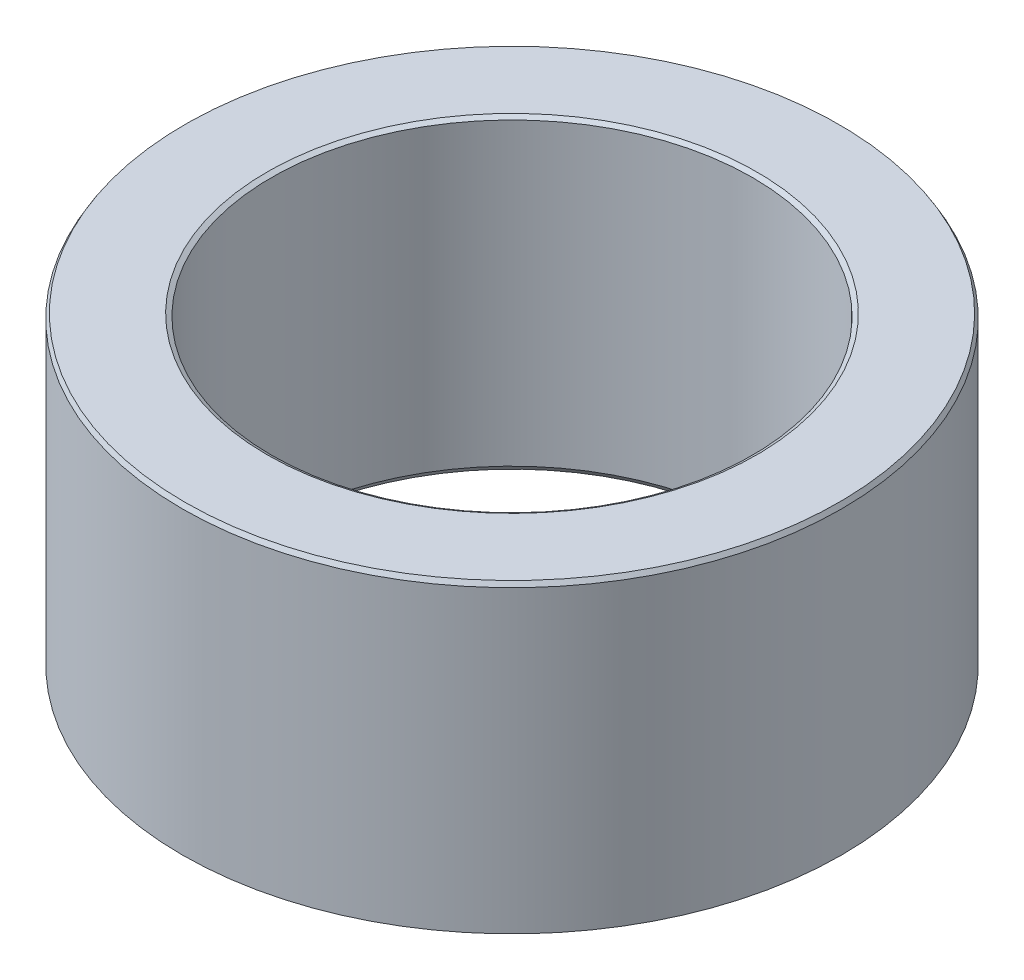
from build123d import *
from OCP.BRepFilletAPI import BRepFilletAPI_MakeChamfer

# Parameters (mm, degrees)
SKETCH1_R           = 42.5
BOSS_EXTRUDE1_DEPTH = 39.545728752
SKETCH2_R           = 31.003507725
CUT_EXTRUDE1_DEPTH  = 72.946957285
CHAMFER1_SIZE       = 0.571269979
CHAMFER1_SIZE2      = 0.329822876


with BuildPart() as part:
    # Sketch1 → Boss-Extrude1 (new body)
    with BuildSketch(Plane(origin=(0, 0, 0), x_dir=(1, 0, 0), z_dir=(0, 1, 0))):
        Circle(SKETCH1_R)
    extrude(amount=BOSS_EXTRUDE1_DEPTH)

    # Sketch2 → Cut-Extrude1 (cut, through all)
    with BuildSketch(Plane(origin=(0, 0, 0), x_dir=(1, 0, 0), z_dir=(0, 1, 0))):
        Circle(SKETCH2_R)
    extrude(amount=CUT_EXTRUDE1_DEPTH, mode=Mode.SUBTRACT)

    # Chamfer1: one chamfer whose edges measure the first distance from different faces: ONE call of the kernel's chamfer builder (chamfer() names one face for all edges)
    chamfer1_edges_1 = [part.edges().sort_by_distance(p)[0] for p in [
        (-31.003507725, 39.545728752, 0),
    ]]
    chamfer1_side_1 = [part.faces().sort_by_distance(p)[0] for p in [
        (-41.297918472, 39.545728752, 0),
    ]]
    chamfer1_edges_2 = [part.edges().sort_by_distance(p)[0] for p in [
        (-31.003507725, 0, 0),
    ]]
    chamfer1_side_2 = [part.faces().sort_by_distance(p)[0] for p in [
        (-31.003507725, 19.772864376, 0),
    ]]
    chamfer1_edges_3 = [part.edges().sort_by_distance(p)[0] for p in [
        (-42.5, 0, 0),
    ]]
    chamfer1_side_3 = [part.faces().sort_by_distance(p)[0] for p in [
        (-41.297918472, 0, 0),
    ]]
    chamfer1_edges_4 = [part.edges().sort_by_distance(p)[0] for p in [
        (-42.5, 39.545728752, 0),
    ]]
    chamfer1_side_4 = [part.faces().sort_by_distance(p)[0] for p in [
        (-42.5, 19.772864376, 0),
    ]]
    chamfer1 = BRepFilletAPI_MakeChamfer(part.part.solid().wrapped)
    for e in chamfer1_edges_1:
        chamfer1.Add(CHAMFER1_SIZE, CHAMFER1_SIZE2, e.wrapped, chamfer1_side_1[0].wrapped)  # the first distance lies on this face
    for e in chamfer1_edges_2:
        chamfer1.Add(CHAMFER1_SIZE, CHAMFER1_SIZE2, e.wrapped, chamfer1_side_2[0].wrapped)  # the first distance lies on this face
    for e in chamfer1_edges_3:
        chamfer1.Add(CHAMFER1_SIZE, CHAMFER1_SIZE2, e.wrapped, chamfer1_side_3[0].wrapped)  # the first distance lies on this face
    for e in chamfer1_edges_4:
        chamfer1.Add(CHAMFER1_SIZE, CHAMFER1_SIZE2, e.wrapped, chamfer1_side_4[0].wrapped)  # the first distance lies on this face
    add(Compound.cast(chamfer1.Shape()), mode=Mode.REPLACE)


solid = part.part
